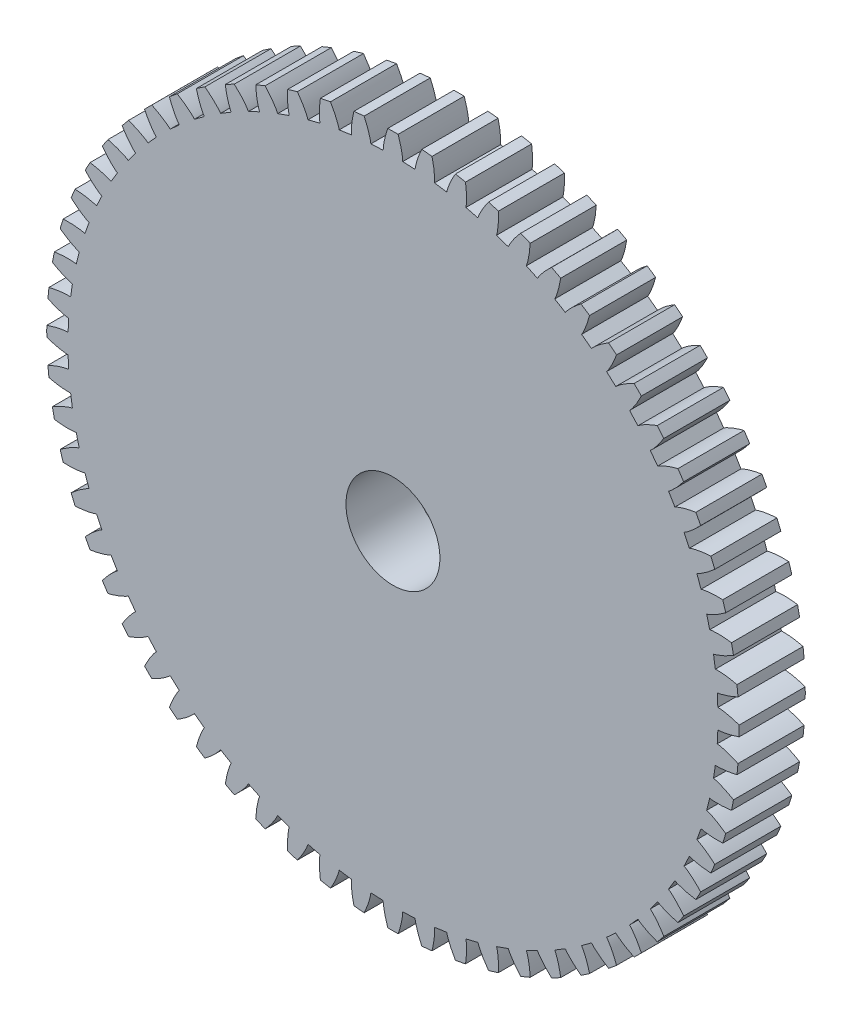
from build123d import *

# Parameters (mm, degrees)
SKETCH1_R               = 52.3875
BOSS_EXTRUDE1_DEPTH     = 10
CUT_EXTRUDE2_DEPTH      = 11
CIRPATTERN1_COUNT       = 64
CUT_EXTRUDE4_DEPTH      = 12
CUT_EXTRUDE4_DEPTH_BACK = 12
SKETCH3_R               = 7.112


with BuildPart() as part:
    # Sketch1 → Boss-Extrude1 (new body)
    with BuildSketch(Plane.XY):
        Circle(SKETCH1_R)
    extrude(amount=BOSS_EXTRUDE1_DEPTH)

    # Sketch2 → Cut-Extrude2 (cut, symmetric)
    with BuildSketch(Plane.XY):
        with BuildLine():
            add(Edge.make_bspline(
                [(49.159639133, 1.479588071), (49.164532349, 1.479697342), (49.178261104, 1.479886221), (49.204235196, 1.479778867), (49.246654771, 1.478943821), (49.300763008, 1.476909208), (49.370777189, 1.473163832), (49.453364186, 1.467315202), (49.544251653, 1.45938075), (49.643281434, 1.449119138), (49.742216894, 1.437438853), (49.841046626, 1.424441558), (49.939623832, 1.41027914), (50.059190432, 1.391684559), (50.202785797, 1.367385769), (50.370974222, 1.336057228), (50.562150691, 1.297065366), (50.757484667, 1.253608942), (50.950107555, 1.207789278), (51.145239697, 1.157959763), (51.334405913, 1.107242401), (51.53146561, 1.050918271), (51.71364732, 0.997077963), (51.918436872, 0.93270049), (52.083896995, 0.879565753), (52.255414681, 0.821277521), (52.33898356, 0.792405599), (52.381731035, 0.777438111)],
                knots=[0, 0, 0, 0, 0, 0.005376749, 0.015083688, 0.02853182, 0.04661014, 0.06485485, 0.092110526, 0.119476176, 0.146842496, 0.174208854, 0.201574956, 0.228941013, 0.256307345, 0.307035032, 0.361767352, 0.416499661, 0.471231937, 0.525964282, 0.580696616, 0.635428982, 0.690161387, 0.744893688, 0.799626082, 0.854358407, 0.909090914, 0.909090914, 0.909090914, 0.909090914, 0.909090914], degree=4))
            Line((52.381731035, 0.777438111), (59.993392739, 0.890408717))
            add(Edge.make_bspline(
                [(59.993392739, 0.890408717), (59.992787708, 0.931174102), (59.991502941, 1.010570522), (59.988055764, 1.210584827), (59.984507625, 1.36359621), (59.979310115, 1.584822535), (59.974081063, 1.765001958), (59.96785059, 1.969926675), (59.961196969, 2.159896403), (59.953784069, 2.358788491), (59.945792547, 2.552406181), (59.937151262, 2.748893749), (59.927840416, 2.944066013), (59.917976201, 3.139211092), (59.907316726, 3.335599513), (59.896291914, 3.529068186), (59.884174285, 3.727729146), (59.872175577, 3.917436287), (59.858289914, 4.121984928), (59.845833116, 4.301809275), (59.829321627, 4.52247978), (59.817854942, 4.67510215), (59.80168069, 4.874491213), (59.79517706, 4.953631247), (59.791783471, 4.994259639)],
                knots=[0.083333333, 0.083333333, 0.083333333, 0.083333333, 0.083333333, 0.123015873, 0.162698413, 0.202380952, 0.242063492, 0.281746032, 0.321428571, 0.361111111, 0.400793651, 0.44047619, 0.48015873, 0.51984127, 0.55952381, 0.599206349, 0.638888889, 0.678571429, 0.718253968, 0.757936508, 0.797619048, 0.837301587, 0.876984127, 0.916666667, 0.916666667, 0.916666667, 0.916666667, 0.916666667], degree=4))
            Line((59.791783471, 4.994259639), (52.205700943, 4.360612948))
            add(Edge.make_bspline(
                [(49.067947025, 3.346023798), (49.07282739, 3.346394672), (49.08650855, 3.347552356), (49.112347047, 3.350205099), (49.154480512, 3.355193969), (49.208128776, 3.36252232), (49.277438709, 3.37311225), (49.359054761, 3.387027659), (49.448726867, 3.403832434), (49.546273979, 3.423751249), (49.64358817, 3.445072661), (49.740668052, 3.467694379), (49.837382422, 3.491450857), (49.954550689, 3.521675475), (50.095072905, 3.559932068), (50.259380723, 3.607595101), (50.445814753, 3.665137778), (50.635948668, 3.727531025), (50.823152912, 3.7920104), (51.012461293, 3.860726266), (51.195745451, 3.929740942), (51.386335522, 4.005109084), (51.562362704, 4.076547066), (51.759856042, 4.16068743), (51.919311315, 4.229784237), (52.08428985, 4.304603468), (52.164626379, 4.341527547), (52.205700943, 4.360612948)],
                knots=[0, 0, 0, 0, 0, 0.005376749, 0.015083688, 0.02853182, 0.04661014, 0.06485485, 0.092110526, 0.119476176, 0.146842496, 0.174208854, 0.201574956, 0.228941013, 0.256307345, 0.307035032, 0.361767352, 0.416499661, 0.471231937, 0.525964282, 0.580696616, 0.635428982, 0.690161387, 0.744893688, 0.799626082, 0.854358407, 0.909090914, 0.909090914, 0.909090914, 0.909090914, 0.909090914], degree=4))
            Line((49.067947025, 3.346023798), (49.159639133, 1.479588071))
        make_face()
    cut_extrude2 = extrude(amount=CUT_EXTRUDE2_DEPTH, both=True, mode=Mode.SUBTRACT)

    # CirPattern1: Cut-Extrude2 ×64 about axis
    cirpattern1_axis = Axis((0, 0, -0.5), (0, 0, 1))
    for i in range(1, CIRPATTERN1_COUNT):
        add(cut_extrude2.rotate(cirpattern1_axis, i * 360 / CIRPATTERN1_COUNT), mode=Mode.SUBTRACT)

    # Sketch3 → Cut-Extrude4 (cut, two sides: drawn at the far end of the back side and taken through both)
    with BuildSketch(Plane.XY.offset(-CUT_EXTRUDE4_DEPTH_BACK)):
        Circle(SKETCH3_R)
    extrude(amount=CUT_EXTRUDE4_DEPTH + CUT_EXTRUDE4_DEPTH_BACK, mode=Mode.SUBTRACT)


solid = part.part
